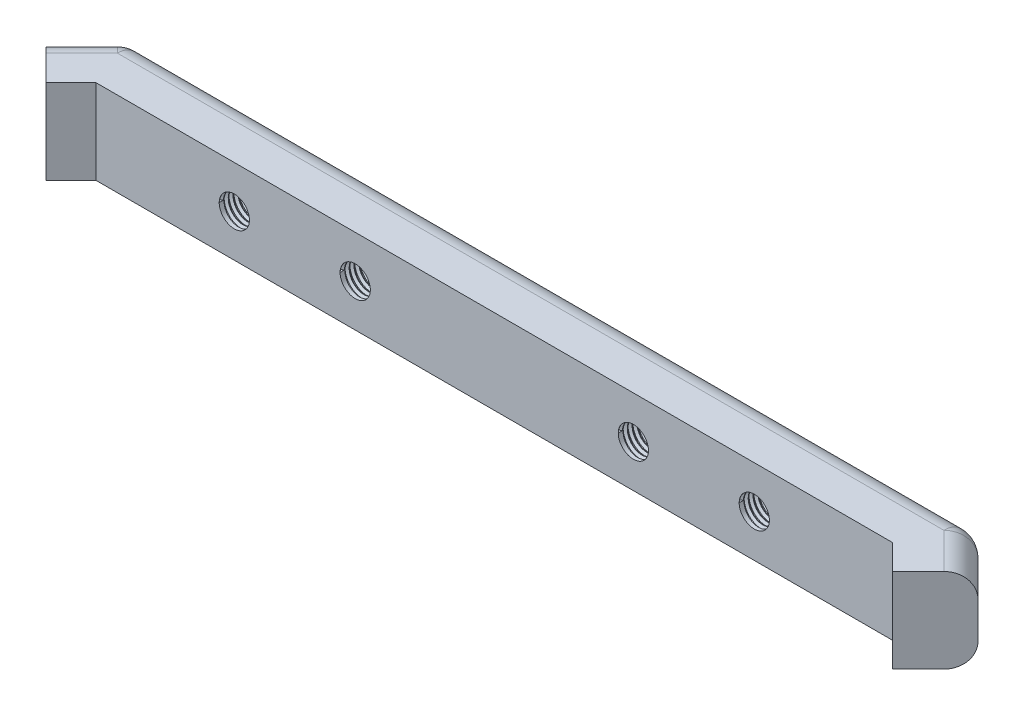
from build123d import *
from build123d.topology import SkipClean

# Parameters (mm, degrees)
BOSS_EXTRUDE1_DEPTH = 70
FILLET1_R           = 20
FILLET2_R           = 20
FILLET3_R           = 20
SKETCH2_R           = 12.5
CUT_EXTRUDE1_DEPTH  = 25
THREAD1_PITCH       = 4
THREAD2_PITCH       = 4
THREAD3_PITCH       = 4
THREAD4_PITCH       = 4


with BuildPart() as part:
    # Sketch1 → Boss-Extrude1 (new body)
    with BuildSketch(Plane(origin=(0, 0, 0), x_dir=(1, 0, 0), z_dir=(0, 1, 0))):
        Polygon((-350, 46.973713774), (350, 46.973713774), (385.355339059, 11.618374715), (350, -23.736964345), (329.289321881, -3.026286226), (-329.289321881, -3.026286226), (-350, -23.736964345), (-385.355339059, 11.618374715), align=None)
    extrude(amount=BOSS_EXTRUDE1_DEPTH)

    # Fillet1
    fillet1_edges = [part.edges().sort_by_distance(p)[0] for p in [
        (350, 35, -46.973713774),
    ]]
    fillet(fillet1_edges, radius=FILLET1_R)

    # Fillet2
    fillet2_edges = [part.edges().sort_by_distance(p)[0] for p in [
        (-350, 35, -46.973713774),
    ]]
    fillet(fillet2_edges, radius=FILLET2_R)

    # Fillet3
    fillet3_edges = [part.edges().sort_by_distance(p)[0] for p in [
        (370.606601718, 0, -26.367112056),
        (0, 0, -46.973713774),
        (0, 70, -46.973713774),
        (349.3693974, 0, -45.451304424),
        (349.3693974, 70, -45.451304424),
        (-370.606601718, 0, -26.367112056),
        (-370.606601718, 70, -26.367112056),
        (-349.3693974, 0, -45.451304424),
        (-349.3693974, 70, -45.451304424),
        (370.606601718, 70, -26.367112056),
    ]]
    fillet(fillet3_edges, radius=FILLET3_R)

    # Sketch2 → Cut-Extrude1 (cut)
    with BuildSketch(Plane.XY.offset(3.026286226)):
        with Locations((-215, 35)):
            Circle(SKETCH2_R)
        with Locations(Location((-115, 35, 0), (0, 0, 180))):
            Circle(SKETCH2_R)
        with Locations((215, 35)):
            Circle(SKETCH2_R)
        with Locations(Location((115, 35, 0), (0, 0, 180))):
            Circle(SKETCH2_R)
    extrude(amount=-CUT_EXTRUDE1_DEPTH, mode=Mode.SUBTRACT)

    # Thread1: the profile of Thread Profile1 profile screwed along a right-hand helix of 6.25 turns, 12 arcs to a turn; built about Z, then put on its axis
    thread1_z = Axis((0, 0, 0), (0, 0, 1))
    thread1_corners = [(12.4997, 0, -0.000173205), (12.4997, 0, 3.500173194), (14.6650635, 0, 2.249999995), (14.6650635, 0, 1.249999995)]
    with BuildLine(mode=Mode.PRIVATE) as thread1_profile:
        Line(thread1_corners[0], thread1_corners[1])
        Line(thread1_corners[1], thread1_corners[2])
        Line(thread1_corners[2], thread1_corners[3])
        Line(thread1_corners[3], thread1_corners[0])
    thread1_cap = Face(thread1_profile.wire())
    thread1_turn_angles = [0, 15, 30, 45, 60, 75, 90, 105, 120, 135, 150, 165, 180, 195, 210, 225, 240, 255, 270, 285, 300, 315, 330, 345, 360]
    thread1_turn_weights = [1, 0.9659258262890683, 1, 0.9659258262890683, 1, 0.9659258262890683, 1, 0.9659258262890683, 1, 0.9659258262890683, 1, 0.9659258262890683, 1, 0.9659258262890683, 1, 0.9659258262890683, 1, 0.9659258262890683, 1, 0.9659258262890683, 1, 0.9659258262890683, 1, 0.9659258262890683, 1]
    thread1_turn_rails = [Edge.make_bspline([Vector(p[0], p[1], 0).rotate(thread1_z, thread1_turn_angles[k]) / thread1_turn_weights[k] + Vector(0, 0, p[2] + THREAD1_PITCH * thread1_turn_angles[k] / 360) for k in range(25)], [0, 0, 0, 1, 1, 2, 2, 3, 3, 4, 4, 5, 5, 6, 6, 7, 7, 8, 8, 9, 9, 10, 10, 11, 11, 12, 12, 12], 2, thread1_turn_weights) for p in thread1_corners]
    thread1_turn_sides = [Face.make_surface_from_curves(thread1_turn_rails[p[0]], thread1_turn_rails[p[1]]) for p in [(0, 1), (1, 2), (2, 3), (3, 0)]]
    thread1_last_angles = [2160, 2175, 2190, 2205, 2220, 2235, 2250]
    thread1_last_weights = [1, 0.9659258262890683, 1, 0.9659258262890683, 1, 0.9659258262890683, 1]
    thread1_last_rails = [Edge.make_bspline([Vector(p[0], p[1], 0).rotate(thread1_z, thread1_last_angles[k]) / thread1_last_weights[k] + Vector(0, 0, p[2] + THREAD1_PITCH * thread1_last_angles[k] / 360) for k in range(7)], [0, 0, 0, 1, 1, 2, 2, 3, 3, 3], 2, thread1_last_weights) for p in thread1_corners]
    thread1_last_sides = [Face.make_surface_from_curves(thread1_last_rails[p[0]], thread1_last_rails[p[1]]) for p in [(0, 1), (1, 2), (2, 3), (3, 0)]]
    thread1 = Plane(origin=(115, 35, 3.026286226), x_dir=(-1, 0, 0), z_dir=(0, 0, -1)) * Solid(Shell([*[p.moved(Location((0, 0, THREAD1_PITCH * i))) for i in range(6) for p in thread1_turn_sides], *thread1_last_sides, thread1_cap, thread1_cap.rotate(thread1_z, 2250).moved(Location((0, 0, THREAD1_PITCH * 2250 / 360)))]))
    add(thread1, mode=Mode.SUBTRACT)

    # Thread2: the profile of Thread Profile2 profile screwed along a right-hand helix of 6.25 turns, 12 arcs to a turn; built about Z, then put on its axis
    with SkipClean():  # the faces are left unmerged after this step: merging them gives an invalid solid
        thread2_z = Axis((0, 0, 0), (0, 0, 1))
        thread2_corners = [(12.4997, 0, -0.000173205), (12.4997, 0, 3.500173194), (14.6650635, 0, 2.249999995), (14.6650635, 0, 1.249999995)]
        with BuildLine(mode=Mode.PRIVATE) as thread2_profile:
            Line(thread2_corners[0], thread2_corners[1])
            Line(thread2_corners[1], thread2_corners[2])
            Line(thread2_corners[2], thread2_corners[3])
            Line(thread2_corners[3], thread2_corners[0])
        thread2_cap = Face(thread2_profile.wire())
        thread2_turn_angles = [0, 15, 30, 45, 60, 75, 90, 105, 120, 135, 150, 165, 180, 195, 210, 225, 240, 255, 270, 285, 300, 315, 330, 345, 360]
        thread2_turn_weights = [1, 0.9659258262890683, 1, 0.9659258262890683, 1, 0.9659258262890683, 1, 0.9659258262890683, 1, 0.9659258262890683, 1, 0.9659258262890683, 1, 0.9659258262890683, 1, 0.9659258262890683, 1, 0.9659258262890683, 1, 0.9659258262890683, 1, 0.9659258262890683, 1, 0.9659258262890683, 1]
        thread2_turn_rails = [Edge.make_bspline([Vector(p[0], p[1], 0).rotate(thread2_z, thread2_turn_angles[k]) / thread2_turn_weights[k] + Vector(0, 0, p[2] + THREAD2_PITCH * thread2_turn_angles[k] / 360) for k in range(25)], [0, 0, 0, 1, 1, 2, 2, 3, 3, 4, 4, 5, 5, 6, 6, 7, 7, 8, 8, 9, 9, 10, 10, 11, 11, 12, 12, 12], 2, thread2_turn_weights) for p in thread2_corners]
        thread2_turn_sides = [Face.make_surface_from_curves(thread2_turn_rails[p[0]], thread2_turn_rails[p[1]]) for p in [(0, 1), (1, 2), (2, 3), (3, 0)]]
        thread2_last_angles = [2160, 2175, 2190, 2205, 2220, 2235, 2250]
        thread2_last_weights = [1, 0.9659258262890683, 1, 0.9659258262890683, 1, 0.9659258262890683, 1]
        thread2_last_rails = [Edge.make_bspline([Vector(p[0], p[1], 0).rotate(thread2_z, thread2_last_angles[k]) / thread2_last_weights[k] + Vector(0, 0, p[2] + THREAD2_PITCH * thread2_last_angles[k] / 360) for k in range(7)], [0, 0, 0, 1, 1, 2, 2, 3, 3, 3], 2, thread2_last_weights) for p in thread2_corners]
        thread2_last_sides = [Face.make_surface_from_curves(thread2_last_rails[p[0]], thread2_last_rails[p[1]]) for p in [(0, 1), (1, 2), (2, 3), (3, 0)]]
        thread2 = Plane(origin=(215, 35, 3.026286226), x_dir=(-1, 0, 0), z_dir=(0, 0, -1)) * Solid(Shell([*[p.moved(Location((0, 0, THREAD2_PITCH * i))) for i in range(6) for p in thread2_turn_sides], *thread2_last_sides, thread2_cap, thread2_cap.rotate(thread2_z, 2250).moved(Location((0, 0, THREAD2_PITCH * 2250 / 360)))]))
        add(thread2, mode=Mode.SUBTRACT)

    # Thread3: the profile of Thread Profile3 profile screwed along a right-hand helix of 6.25 turns, 12 arcs to a turn; built about Z, then put on its axis
    with SkipClean():  # the faces are left unmerged after this step: merging them gives an invalid solid
        thread3_z = Axis((0, 0, 0), (0, 0, 1))
        thread3_corners = [(12.4997, 0, -0.000173205), (12.4997, 0, 3.500173194), (14.6650635, 0, 2.249999995), (14.6650635, 0, 1.249999995)]
        with BuildLine(mode=Mode.PRIVATE) as thread3_profile:
            Line(thread3_corners[0], thread3_corners[1])
            Line(thread3_corners[1], thread3_corners[2])
            Line(thread3_corners[2], thread3_corners[3])
            Line(thread3_corners[3], thread3_corners[0])
        thread3_cap = Face(thread3_profile.wire())
        thread3_turn_angles = [0, 15, 30, 45, 60, 75, 90, 105, 120, 135, 150, 165, 180, 195, 210, 225, 240, 255, 270, 285, 300, 315, 330, 345, 360]
        thread3_turn_weights = [1, 0.9659258262890683, 1, 0.9659258262890683, 1, 0.9659258262890683, 1, 0.9659258262890683, 1, 0.9659258262890683, 1, 0.9659258262890683, 1, 0.9659258262890683, 1, 0.9659258262890683, 1, 0.9659258262890683, 1, 0.9659258262890683, 1, 0.9659258262890683, 1, 0.9659258262890683, 1]
        thread3_turn_rails = [Edge.make_bspline([Vector(p[0], p[1], 0).rotate(thread3_z, thread3_turn_angles[k]) / thread3_turn_weights[k] + Vector(0, 0, p[2] + THREAD3_PITCH * thread3_turn_angles[k] / 360) for k in range(25)], [0, 0, 0, 1, 1, 2, 2, 3, 3, 4, 4, 5, 5, 6, 6, 7, 7, 8, 8, 9, 9, 10, 10, 11, 11, 12, 12, 12], 2, thread3_turn_weights) for p in thread3_corners]
        thread3_turn_sides = [Face.make_surface_from_curves(thread3_turn_rails[p[0]], thread3_turn_rails[p[1]]) for p in [(0, 1), (1, 2), (2, 3), (3, 0)]]
        thread3_last_angles = [2160, 2175, 2190, 2205, 2220, 2235, 2250]
        thread3_last_weights = [1, 0.9659258262890683, 1, 0.9659258262890683, 1, 0.9659258262890683, 1]
        thread3_last_rails = [Edge.make_bspline([Vector(p[0], p[1], 0).rotate(thread3_z, thread3_last_angles[k]) / thread3_last_weights[k] + Vector(0, 0, p[2] + THREAD3_PITCH * thread3_last_angles[k] / 360) for k in range(7)], [0, 0, 0, 1, 1, 2, 2, 3, 3, 3], 2, thread3_last_weights) for p in thread3_corners]
        thread3_last_sides = [Face.make_surface_from_curves(thread3_last_rails[p[0]], thread3_last_rails[p[1]]) for p in [(0, 1), (1, 2), (2, 3), (3, 0)]]
        thread3 = Plane(origin=(-115, 35, 3.026286226), x_dir=(-1, 0, 0), z_dir=(0, 0, -1)) * Solid(Shell([*[p.moved(Location((0, 0, THREAD3_PITCH * i))) for i in range(6) for p in thread3_turn_sides], *thread3_last_sides, thread3_cap, thread3_cap.rotate(thread3_z, 2250).moved(Location((0, 0, THREAD3_PITCH * 2250 / 360)))]))
        add(thread3, mode=Mode.SUBTRACT)

    # Thread4: the profile of Thread Profile4 profile screwed along a right-hand helix of 6.25 turns, 12 arcs to a turn; built about Z, then put on its axis
    with SkipClean():  # the faces are left unmerged after this step: merging them gives an invalid solid
        thread4_z = Axis((0, 0, 0), (0, 0, 1))
        thread4_corners = [(12.4997, 0, -0.000173205), (12.4997, 0, 3.500173194), (14.6650635, 0, 2.249999995), (14.6650635, 0, 1.249999995)]
        with BuildLine(mode=Mode.PRIVATE) as thread4_profile:
            Line(thread4_corners[0], thread4_corners[1])
            Line(thread4_corners[1], thread4_corners[2])
            Line(thread4_corners[2], thread4_corners[3])
            Line(thread4_corners[3], thread4_corners[0])
        thread4_cap = Face(thread4_profile.wire())
        thread4_turn_angles = [0, 15, 30, 45, 60, 75, 90, 105, 120, 135, 150, 165, 180, 195, 210, 225, 240, 255, 270, 285, 300, 315, 330, 345, 360]
        thread4_turn_weights = [1, 0.9659258262890683, 1, 0.9659258262890683, 1, 0.9659258262890683, 1, 0.9659258262890683, 1, 0.9659258262890683, 1, 0.9659258262890683, 1, 0.9659258262890683, 1, 0.9659258262890683, 1, 0.9659258262890683, 1, 0.9659258262890683, 1, 0.9659258262890683, 1, 0.9659258262890683, 1]
        thread4_turn_rails = [Edge.make_bspline([Vector(p[0], p[1], 0).rotate(thread4_z, thread4_turn_angles[k]) / thread4_turn_weights[k] + Vector(0, 0, p[2] + THREAD4_PITCH * thread4_turn_angles[k] / 360) for k in range(25)], [0, 0, 0, 1, 1, 2, 2, 3, 3, 4, 4, 5, 5, 6, 6, 7, 7, 8, 8, 9, 9, 10, 10, 11, 11, 12, 12, 12], 2, thread4_turn_weights) for p in thread4_corners]
        thread4_turn_sides = [Face.make_surface_from_curves(thread4_turn_rails[p[0]], thread4_turn_rails[p[1]]) for p in [(0, 1), (1, 2), (2, 3), (3, 0)]]
        thread4_last_angles = [2160, 2175, 2190, 2205, 2220, 2235, 2250]
        thread4_last_weights = [1, 0.9659258262890683, 1, 0.9659258262890683, 1, 0.9659258262890683, 1]
        thread4_last_rails = [Edge.make_bspline([Vector(p[0], p[1], 0).rotate(thread4_z, thread4_last_angles[k]) / thread4_last_weights[k] + Vector(0, 0, p[2] + THREAD4_PITCH * thread4_last_angles[k] / 360) for k in range(7)], [0, 0, 0, 1, 1, 2, 2, 3, 3, 3], 2, thread4_last_weights) for p in thread4_corners]
        thread4_last_sides = [Face.make_surface_from_curves(thread4_last_rails[p[0]], thread4_last_rails[p[1]]) for p in [(0, 1), (1, 2), (2, 3), (3, 0)]]
        thread4 = Plane(origin=(-215, 35, 3.026286226), x_dir=(-1, 0, 0), z_dir=(0, 0, -1)) * Solid(Shell([*[p.moved(Location((0, 0, THREAD4_PITCH * i))) for i in range(6) for p in thread4_turn_sides], *thread4_last_sides, thread4_cap, thread4_cap.rotate(thread4_z, 2250).moved(Location((0, 0, THREAD4_PITCH * 2250 / 360)))]))
        add(thread4, mode=Mode.SUBTRACT)


solid = part.part
